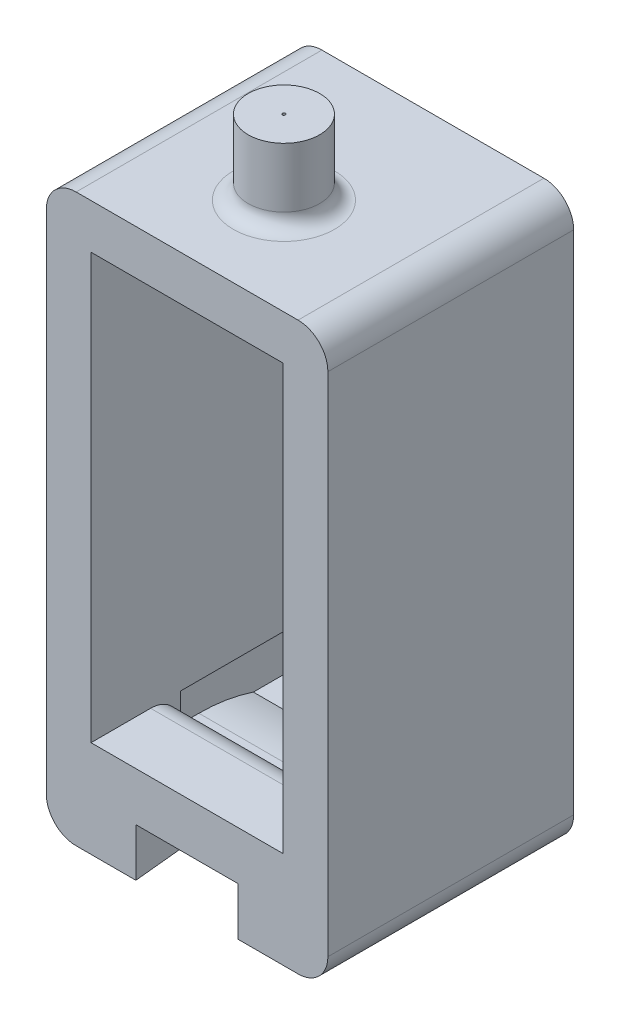
from build123d import *

# Parameters (mm, degrees)
SKETCH_1_W                = 32.6
SKETCH_1_H                = 34.6
SKETCH_1_R                = 1.1
SKETCH_1_R_2              = 1.25
SKETCH_1_W_2              = 24.6
SKETCH_1_H_2              = 24.2
EXTRUDE_1_DEPTH           = 13
SKETCH_3_W                = 6.5
SKETCH_3_H                = 6.519005167
CUT_EXTRUDE_1_DEPTH       = 19
SKETCH_4_W                = 6.5
SKETCH_4_H                = 6.467668889
CUT_EXTRUDE_2_DEPTH       = 23
EXTRUDE_2_DEPTH           = 50
SKETCH_1_2_W              = 22.27659965
SKETCH_1_2_H              = 4.598586669
SKETCH_1_2_W_2            = 22.283050596
SKETCH_1_2_H_2            = 4.977540741
CUT_EXTRUDE_5_DEPTH       = 34
FILLET_1_R                = 2
FILLET_2_R                = 2
SKETCH_9_W                = 54.594998093
SKETCH_9_H                = 18.111982385
SKETCH_9_W_2              = 52.534809486
SKETCH_9_H_2              = 12.989301534
CUT_EXTRUDE_6_DEPTH       = 41
FILLET_6_R                = 22
EXTRUDE_4_DEPTH           = 13
SKETCH_13_W               = 5.518907879
SKETCH_13_H               = 8.361822047
CUT_EXTRUDE_8_DEPTH       = 8.5
SKETCH_14_W               = 6.038657432
SKETCH_14_H               = 7.741248121
CUT_EXTRUDE_9_DEPTH       = 8.5
SKETCH_23_OUTSIDE_W       = 35.102
SKETCH_23_OUTSIDE_H       = 56.702
SKETCH_23_OUTSIDE_W_2     = 1.5
SKETCH_23_OUTSIDE_H_2     = 34.6
CUT_EXTRUDE_10_DEPTH      = 104
SKETCH_24_W               = 10.341780897
SKETCH_24_H               = 5.2
SKETCH_24_R               = 1.25
EXTRUDE_5_DEPTH           = 1.5
SKETCH_25_R               = 1.25
CUT_EXTRUDE_11_DEPTH      = 104
SKETCH_26_OUTSIDE_W       = 115.402
SKETCH_26_OUTSIDE_H       = 56.536
SKETCH_26_OUTSIDE_W_2     = 17.268409177
SKETCH_26_OUTSIDE_H_2     = 34.6
CUT_EXTRUDE_12_DEPTH      = 10
SKETCH_27_W               = 2.368409177
SKETCH_27_H               = 25.781356428
EXTRUDE_6_DEPTH           = 1.5
SKETCH_28_R               = 1.1
CUT_EXTRUDE_13_DEPTH      = 10
CUT_EXTRUDE_START         = -2
CUT_EXTRUDE_14_OUTLINE_W  = 0.368409177
CUT_EXTRUDE_14_OUTLINE_H  = 34.6
CUT_EXTRUDE_14_DEPTH      = 3
SKETCH_30_W               = 15.411127821
SKETCH_30_H               = 34.6
EXTRUDE_7_DEPTH           = 1.5
SKETCH_33_W               = 23.9
SKETCH_33_H               = 38.011921137
SKETCH_33_R               = 1.1
EXTRUDE_8_DEPTH           = 15
SKETCH_34_OUTSIDE_W       = 35.468
SKETCH_34_OUTSIDE_H       = 49.58
SKETCH_34_OUTSIDE_W_2     = 18.899009792
SKETCH_34_OUTSIDE_H_2     = 43.211027868
CUT_EXTRUDE_15_DEPTH      = 13.5
SKETCH_35_W               = 12.9
SKETCH_35_H               = 31.784162084
CUT_EXTRUDE_16_DEPTH      = 11
SKETCH_37_R               = 2.4
EXTRUDE_9_DEPTH           = 5
SKETCH_39_W               = 13.171271292
SKETCH_39_H               = 33.849019387
CUT_EXTRUDE_17_DEPTH      = 3
FILLET_7_R                = 3
CUT_EXTRUDE_18_DEPTH      = 53.759852886
CUT_EXTRUDE_18_DEPTH_BACK = 53.759852886
SKETCH_40_R               = 0.1
SKETCH_42_W               = 13.648654979
SKETCH_42_H               = 4.665334349
EXTRUDE_10_DEPTH          = 11
CUT_EXTRUDE_19_DEPTH      = 4.493948053
SKETCH_43_R               = 3.607554058
CUT_EXTRUDE_20_DEPTH      = 1
SKETCH_44_W               = 12.990377478
SKETCH_44_H               = 2.596310078
CUT_EXTRUDE_21_DEPTH      = 7.5
SKETCH_46_W               = 13.018615597
SKETCH_46_H               = 10.987054625
EXTRUDE_11_DEPTH          = 1.259502583
SKETCH_48_W               = 7.320827495
SKETCH_48_H               = 3.139430645
EXTRUDE_12_DEPTH          = 1
FILLET_9_R                = 11.5
FILLET_11_R               = 2
CUT_EXTRUDE_23_DEPTH      = 41.086666278
CUT_EXTRUDE_23_DEPTH_BACK = 41.086666278
SKETCH_50_W               = 13.704348931
SKETCH_50_H               = 44.342522193
SKETCH_50_W_2             = 6.251475496
FILLET_12_R               = 2
FILLET_13_R               = 1


with BuildPart() as part:
    # Sketch 1 → 凸台-拉伸1 (new body)
    with BuildSketch(Plane.XY):
        with Locations((-9.850980392, 1.274712581)):
            Rectangle(SKETCH_1_W, SKETCH_1_H)
        with Locations(Location((-15.700980392, 15.424712581, 0), (0, 0, 180))):
            Circle(SKETCH_1_R, mode=Mode.SUBTRACT)
        with Locations(Location((-3.600980392, 15.424712581, 0), (0, 0, 180))):
            Circle(SKETCH_1_R_2, mode=Mode.SUBTRACT)
        with Locations(Location((-15.700980392, -12.875287419, 0), (0, 0, 180))):
            Circle(SKETCH_1_R_2, mode=Mode.SUBTRACT)
        with Locations(Location((-3.600980392, -12.875287419, 0), (0, 0, 180))):
            Circle(SKETCH_1_R_2, mode=Mode.SUBTRACT)
        with Locations((-9.850980392, 1.274712581)):
            Rectangle(SKETCH_1_W_2, SKETCH_1_H_2, mode=Mode.SUBTRACT)
    extrude(amount=EXTRUDE_1_DEPTH)

    # 草图3 → 切除-拉伸1 (cut)
    with BuildSketch(Plane(origin=(0, 0, 0), x_dir=(-1, 0, 0), z_dir=(0, 0, -1))):
        with Locations((15.700980392, -10.82528742)):
            Rectangle(SKETCH_3_W, SKETCH_3_H)
    extrude(amount=-CUT_EXTRUDE_1_DEPTH, mode=Mode.SUBTRACT)

    # 草图4 → 切除-拉伸2 (cut)
    with BuildSketch(Plane.XY.offset(13)):
        with Locations((-3.600980392, -10.82528742)):
            Rectangle(SKETCH_4_W, SKETCH_4_H)
    extrude(amount=-CUT_EXTRUDE_2_DEPTH, mode=Mode.SUBTRACT)

    # 草图5 → 凸台-拉伸2 (add)
    with BuildSketch(Plane(origin=(6.449019608, 0, 0), x_dir=(0, 0, -1), z_dir=(1, 0, 0))):
        Polygon((-13, 18.574712581), (-13, 10.055461473), (-13, -16.025287419), (0, -16.025287419), (0, -15.027567927), (0, 16.282461831), (0, 18.574712581), align=None)
    extrude(amount=EXTRUDE_2_DEPTH)

    # Sketch 1 2 → 切除-拉伸5 (cut)
    with BuildSketch(Plane.XY.offset(13)):
        with Locations((24.037173058, -7.263594431)):
            Rectangle(SKETCH_1_2_W, SKETCH_1_2_H)
        with Locations((24.078382453, 0.81654228)):
            Rectangle(SKETCH_1_2_W_2, SKETCH_1_2_H_2)
    extrude(amount=-CUT_EXTRUDE_5_DEPTH, mode=Mode.SUBTRACT)

    # 圆角1
    fillet_1_edges = [part.edges().sort_by_distance(p)[0] for p in [
        (12.936857155, -1.672228091, 6.5),
        (12.936857155, 3.30531265, 6.5),
        (35.219907751, 3.30531265, 6.5),
        (35.219907751, -1.672228091, 6.5),
        (12.898873233, -9.562887765, 6.5),
        (12.898873233, -4.964301096, 6.5),
        (35.175472883, -4.964301096, 6.5),
        (35.175472883, -9.562887765, 6.5),
    ]]
    fillet(fillet_1_edges, radius=FILLET_1_R)

    # 圆角2
    fillet_2_edges = [part.edges().sort_by_distance(p)[0] for p in [
        (-26.150980392, -16.025287419, 6.5),
        (-26.150980392, 18.574712581, 6.5),
    ]]
    fillet(fillet_2_edges, radius=FILLET_2_R)

    # 草图9 → 切除-拉伸6 (cut)
    with BuildSketch(Plane(origin=(0, 0, 0), x_dir=(-1, 0, 0), z_dir=(0, 0, -1))):
        with Locations((-36.934177516, 16.051357777)):
            Rectangle(SKETCH_9_W, SKETCH_9_H)
        with Locations((-36.653242706, -19.247200889)):
            Rectangle(SKETCH_9_W_2, SKETCH_9_H_2)
    extrude(amount=-CUT_EXTRUDE_6_DEPTH, mode=Mode.SUBTRACT)

    # 圆角6
    # the kernel refuses this fillet: 22 mm, written as the material it adds along each edge
    with BuildSketch(Plane(origin=(9.636678469, 6.995366584, 0), x_dir=(0, 1, 0), z_dir=(0, 0, 1))) as fillet_6_piece_1:
        with BuildLine():
            CenterArc((22, -19.375499223), FILLET_6_R, 118.272534833, 61.727465167)
            Line((0, -19.375499223), (-0.44, -19.375499223))
            Line((-0.44, -19.375499223), (-0.44, 0))
            Line((-0.44, 0), (0, 0.44))
            ThreePointArc((0, 0.44), (5.789672998, 0.44), (11.370932916, 0.387509984))
            Line((11.370932916, 0.387509984), (11.579345996, 0))
        make_face()
    extrude(amount=13)
    with BuildSketch(Plane(origin=(10.385837963, -12.752550122, 0), x_dir=(1, 0, 0), z_dir=(0, 0, 1))) as fillet_6_piece_2:
        with BuildLine():
            CenterArc((11.54511289, -22), FILLET_6_R, 90, 31.653290012)
            Line((0, -3.272737297), (-0.230902258, -2.898192043))
            ThreePointArc((-0.230902258, -2.898192043), (-0.44, -1.636368649), (-0.44, 0))
            Line((-0.44, 0), (0, 0.44))
            Line((0, 0.44), (11.54511289, 0.44))
            Line((11.54511289, 0.44), (11.54511289, 0))
        make_face()
    extrude(amount=13)

    # 草图12 → 凸台-拉伸4 (add)
    with BuildSketch(Plane(origin=(0, 0, 0), x_dir=(-1, 0, 0), z_dir=(0, 0, -1))):
        with BuildLine():
            Line((24.150980392, 18.574712581), (24.496655084, -15.99518818))
            ThreePointArc((24.496655084, -15.99518818), (37.015647173, 1.416671567), (24.150980392, 18.574712581))
        make_face()
        with BuildLine():
            Line((26.822698684, 1.289948959), (26.822698684, -8.431688638))
            ThreePointArc((26.822698684, -8.431688638), (32.027920461, 1.289948959), (26.822698684, 11.011586556))
            Line((26.822698684, 11.011586556), (26.822698684, 1.289948959))
        make_face(mode=Mode.SUBTRACT)
    extrude(amount=-EXTRUDE_4_DEPTH)

    # 草图13 → 切除-拉伸8 (cut)
    with BuildSketch(Plane.XY.offset(13)):
        with Locations((-3.600980393, 15.424712581)):
            Rectangle(SKETCH_13_W, SKETCH_13_H)
    extrude(amount=-CUT_EXTRUDE_8_DEPTH, mode=Mode.SUBTRACT)

    # 草图14 → 切除-拉伸9 (cut)
    with BuildSketch(Plane(origin=(0, 0, 0), x_dir=(-1, 0, 0), z_dir=(0, 0, -1))):
        with Locations((15.700980392, 15.424712581)):
            Rectangle(SKETCH_14_W, SKETCH_14_H)
    extrude(amount=-CUT_EXTRUDE_9_DEPTH, mode=Mode.SUBTRACT)

    # 草图23 outside → 切除-拉伸10 (cut)
    with BuildSketch(Plane(origin=(56.449019608, 0, 0), x_dir=(0, 0, -1), z_dir=(1, 0, 0))):
        with Locations((-6.5, 1.275)):
            Rectangle(SKETCH_23_OUTSIDE_W, SKETCH_23_OUTSIDE_H)
        with Locations((-12.25, 1.274712581)):
            Rectangle(SKETCH_23_OUTSIDE_W_2, SKETCH_23_OUTSIDE_H_2, mode=Mode.SUBTRACT)
    extrude(amount=-CUT_EXTRUDE_10_DEPTH, mode=Mode.SUBTRACT)

    # 草图24 → 凸台-拉伸5 (add)
    with BuildSketch(Plane.XY.offset(13)):
        with Locations((-4.17557206, 15.974712581)):
            Rectangle(SKETCH_24_W, SKETCH_24_H)
        with Locations((-3.600980392, 15.429779286)):
            Circle(SKETCH_24_R, mode=Mode.SUBTRACT)
    extrude(amount=-EXTRUDE_5_DEPTH)

    # 草图25 → 切除-拉伸11 (cut)
    with BuildSketch(Plane.XY.offset(13)):
        with Locations((42.624971711, -3.793205976)):
            Circle(SKETCH_25_R)
        with Locations((-34.434765713, 1.289948959)):
            Circle(SKETCH_25_R)
        with Locations((-25.484048207, 14.316394652)):
            Circle(SKETCH_25_R)
        with Locations((-25.484048207, -12.050711449)):
            Circle(SKETCH_25_R)
    extrude(amount=-CUT_EXTRUDE_11_DEPTH, mode=Mode.SUBTRACT)

    # 草图26 outside → 切除-拉伸12 (cut)
    with BuildSketch(Plane.XY.offset(13)):
        with Locations((9.716, 1.275)):
            Rectangle(SKETCH_26_OUTSIDE_W, SKETCH_26_OUTSIDE_H)
        with Locations((-15.516775803, 1.274712581)):
            Rectangle(SKETCH_26_OUTSIDE_W_2, SKETCH_26_OUTSIDE_H_2, mode=Mode.SUBTRACT)
    extrude(amount=-CUT_EXTRUDE_12_DEPTH, mode=Mode.SUBTRACT)

    # 草图27 → 凸台-拉伸6 (add)
    with BuildSketch(Plane.XY.offset(13)):
        with Locations((-8.066775804, 0.484034367)):
            Rectangle(SKETCH_27_W, SKETCH_27_H)
    extrude(amount=-EXTRUDE_6_DEPTH)

    # 草图28 → 切除-拉伸13 (cut)
    with BuildSketch(Plane.XY.offset(13)):
        with Locations((-19.200980392, 15.384992379)):
            Circle(SKETCH_28_R)
        with Locations((-12.200980392, 15.384992379)):
            Circle(SKETCH_28_R)
    extrude(amount=-CUT_EXTRUDE_13_DEPTH, mode=Mode.SUBTRACT)

    # 切除-拉伸14: read off the stored shape, not the designer's step
    # 切除-拉伸14 outline → 切除-拉伸14 (cut)
    with BuildSketch(Plane.XY.offset(13).offset(CUT_EXTRUDE_START)):
        with Locations((-7.066775804, 1.274712581)):
            Rectangle(CUT_EXTRUDE_14_OUTLINE_W, CUT_EXTRUDE_14_OUTLINE_H)
    extrude(amount=CUT_EXTRUDE_14_DEPTH, mode=Mode.SUBTRACT)

    # 草图30 → 凸台-拉伸7 (add)
    with BuildSketch(Plane.XY.offset(13)):
        Polygon((-27.650980392, 18.574712581), (-27.650980392, -16.025287419), (-27.650980392, -17.319235473), (-3.750980392, -17.319235473), (-3.750980392, -16.025287419), (-3.750980392, 18.574712581), (-3.750980392, 20.692685664), (-27.650980392, 20.692685664), align=None)
        with Locations((-15.213421192, 1.274712581)):
            Rectangle(SKETCH_30_W, SKETCH_30_H, mode=Mode.SUBTRACT)
    extrude(amount=-EXTRUDE_7_DEPTH)

    # 草图33 → 凸台-拉伸8 (add)
    with BuildSketch(Plane(origin=(0, 0, 11.5), x_dir=(-1, 0, 0), z_dir=(0, 0, -1))):
        with Locations((15.700980392, 1.686725095)):
            Rectangle(SKETCH_33_W, SKETCH_33_H)
        with Locations((15.700980392, 15.424712581)):
            Circle(SKETCH_33_R, mode=Mode.SUBTRACT)
        with Locations(Location((12.200980392, 15.384992379, 0), (0, 0, 180))):
            Circle(SKETCH_33_R, mode=Mode.SUBTRACT)
        with Locations(Location((19.200980392, 15.384992379, 0), (0, 0, 180))):
            Circle(SKETCH_33_R, mode=Mode.SUBTRACT)
        with BuildLine():
            Line((9.250980392, -10.825287419), (12.450980392, -10.825287419))
            Line((12.450980392, -10.825287419), (12.450980392, -14.084790003))
            Line((12.450980392, -14.084790003), (15.385380168, -14.084790003))
            ThreePointArc((15.385380168, -14.084790003), (15.700980392, -14.125287419), (16.016580616, -14.084790003))
            Line((16.016580616, -14.084790003), (18.950980392, -14.084790003))
            Line((18.950980392, -14.084790003), (18.950980392, -10.825287419))
            Line((18.950980392, -10.825287419), (22.150980392, -10.825287419))
            Line((22.150980392, -10.825287419), (22.150980392, 13.374712581))
            Line((22.150980392, 13.374712581), (9.250980392, 13.374712581))
            Line((9.250980392, 13.374712581), (9.250980392, -10.825287419))
        make_face(mode=Mode.SUBTRACT)
    extrude(amount=EXTRUDE_8_DEPTH)

    # 草图34 outside → 切除-拉伸15 (cut)
    with BuildSketch(Plane.XY.offset(13)):
        with Locations((-15.701, 1.687)):
            Rectangle(SKETCH_34_OUTSIDE_W, SKETCH_34_OUTSIDE_H)
        with Locations((-15.700980392, 2.766642636)):
            Rectangle(SKETCH_34_OUTSIDE_W_2, SKETCH_34_OUTSIDE_H_2, mode=Mode.SUBTRACT)
    extrude(amount=-CUT_EXTRUDE_15_DEPTH, mode=Mode.SUBTRACT)

    # 草图35 → 切除-拉伸16 (cut)
    with BuildSketch(Plane.XY.offset(13)):
        with Locations((-15.700980392, 1.798395824)):
            Rectangle(SKETCH_35_W, SKETCH_35_H)
    extrude(amount=-CUT_EXTRUDE_16_DEPTH, mode=Mode.SUBTRACT)

    # 草图37 → 凸台-拉伸9 (add)
    with BuildSketch(Plane(origin=(0, 20.692685664, 0), x_dir=(1, 0, 0), z_dir=(0, 1, 0))):
        with Locations(Location((-15.700980392, -6.5, 0), (0, 0, 270))):
            Circle(SKETCH_37_R)
    extrude(amount=EXTRUDE_9_DEPTH)

    # 草图39 → 切除-拉伸17 (cut)
    with BuildSketch(Plane(origin=(0, 0, -3.5), x_dir=(-1, 0, 0), z_dir=(0, 0, -1))):
        with Locations((15.655722224, 1.624936556)):
            Rectangle(SKETCH_39_W, SKETCH_39_H)
    extrude(amount=-CUT_EXTRUDE_17_DEPTH, mode=Mode.SUBTRACT)

    # 圆角7
    fillet_7_edges = [part.edges().sort_by_distance(p)[0] for p in [
        (-3.750980392, 20.692685664, -2),
        (-27.650980392, 20.692685664, -2),
        (-27.650980392, -17.319235473, -2),
        (-3.750980392, -17.319235473, -2),
    ]]
    fillet(fillet_7_edges, radius=FILLET_7_R)

    # 草图40 → 切除-拉伸18 (cut, two sides: drawn at the far end of the back side and taken through both)
    with BuildSketch(Plane(origin=(0, 25.692685664, 0), x_dir=(1, 0, 0), z_dir=(0, 1, 0)).offset(-CUT_EXTRUDE_18_DEPTH_BACK)):
        with Locations(Location((-15.700980392, -6.5, 0), (0, 0, 270))):
            Circle(SKETCH_40_R)
    extrude(amount=CUT_EXTRUDE_18_DEPTH + CUT_EXTRUDE_18_DEPTH_BACK, mode=Mode.SUBTRACT)

    # 草图42 → 凸台-拉伸10 (add)
    with BuildSketch(Plane.XY.offset(2)):
        with Locations((-15.66246504, -13.157954594)):
            Rectangle(SKETCH_42_W, SKETCH_42_H)
    extrude(amount=EXTRUDE_10_DEPTH)

    # 草图41 → 切除-拉伸19 (cut)
    with BuildSketch(Plane.XZ.offset(17.319235473)):
        with BuildLine():
            Line((-19.775980392, 6.5), (-18.406082759, 20.501521641))
            ThreePointArc((-18.406082759, 20.501521641), (-15.665794747, 23.749766381), (-13.011106202, 20.431197259))
            Line((-13.011106202, 20.431197259), (-11.625980392, 6.5))
            ThreePointArc((-11.625980392, 6.5), (-15.700980392, 2.425), (-19.775980392, 6.5))
        make_face()
    extrude(amount=-CUT_EXTRUDE_19_DEPTH, mode=Mode.SUBTRACT)

    # 草图43 → 切除-拉伸20 (cut)
    with BuildSketch(Plane.XZ.offset(12.825287419)):
        with Locations(Location((-15.700980392, 6.5, 0), (0, 0, 270))):
            Circle(SKETCH_43_R)
    extrude(amount=-CUT_EXTRUDE_20_DEPTH, mode=Mode.SUBTRACT)

    # 草图44 → 切除-拉伸21 (cut)
    with BuildSketch(Plane(origin=(0, 0, -0.5), x_dir=(-1, 0, 0), z_dir=(0, 0, -1))):
        with Locations((15.746169131, -12.123442458)):
            Rectangle(SKETCH_44_W, SKETCH_44_H)
    extrude(amount=-CUT_EXTRUDE_21_DEPTH, mode=Mode.SUBTRACT)

    # 草图46 → 凸台-拉伸11 (add)
    with BuildSketch(Plane.XZ.offset(12.825287419)):
        with Locations((-15.749811773, 7.506472688)):
            Rectangle(SKETCH_46_W, SKETCH_46_H)
    extrude(amount=EXTRUDE_11_DEPTH)

    # 草图48 → 凸台-拉伸12 (add)
    with BuildSketch(Plane.XZ.offset(11.825287419)):
        with Locations((-15.761363582, 8.5864607)):
            Rectangle(SKETCH_48_W, SKETCH_48_H)
    extrude(amount=EXTRUDE_12_DEPTH)

    # 圆角9
    # the kernel refuses this fillet: 11.5 mm, written as the material it takes off along each edge
    with BuildSketch(Plane(origin=(-22.24135787, -12.825287419, 2.012945375), x_dir=(0, -1.0, 1.3077435417698884e-12), z_dir=(1, 0, 0))) as fillet_9_piece_1:
        with BuildLine():
            CenterArc((11.5, -3.655071281), FILLET_9_R, 161.468118769, 18.531881231)
            Line((0, -3.655071281), (0, 0))
            Line((0, 0), (0.596310077, 0))
        make_face()
    extrude(amount=12.990377478, mode=Mode.SUBTRACT)

    # 圆角11
    # the kernel refuses this fillet: 2 mm, written as the material it takes off along each edge
    with BuildSketch(Plane(origin=(-9.250980392, -10.825287419, 7), x_dir=(0, 0, 1), z_dir=(-1, 0, 0))) as fillet_11_piece_1:
        with BuildLine():
            CenterArc((FILLET_11_R, -FILLET_11_R), FILLET_11_R, 90, 90)
            Line((0, -FILLET_11_R), (0, 0))
            Line((0, 0), (FILLET_11_R, 0))
        make_face()
    extrude(amount=12.9, mode=Mode.SUBTRACT)

    # 草图50 → 切除-拉伸23 (cut, two sides: drawn at the far end of the back side and taken through both)
    with BuildSketch(Plane.XY.offset(-0.5).offset(-CUT_EXTRUDE_23_DEPTH_BACK)):
        with Locations((-32.002659754, -1.520451896)):
            Rectangle(SKETCH_50_W, SKETCH_50_H)
        with Locations((-3.125737748, -1.520451896)):
            Rectangle(SKETCH_50_W_2, SKETCH_50_H)
    extrude(amount=CUT_EXTRUDE_23_DEPTH + CUT_EXTRUDE_23_DEPTH_BACK, mode=Mode.SUBTRACT)

    # 圆角12
    # the kernel refuses this fillet: 2 mm, written as the material it takes off along each edge
    with BuildSketch(Plane(origin=(-25.150485288, -17.27735901, 18.001095904), x_dir=(0.9997808672786077, -0.02093364334354982, 0), z_dir=(0, 0, -1))) as fillet_12_piece_1:
        with BuildLine():
            CenterArc((1.958571075, -1.999561735), FILLET_12_R, 88.800502969, 90)
            Line((-0.04099066, -1.957694448), (-0.240946833, -1.953507719))
            Line((-0.240946833, -1.953507719), (-0.199956173, 0.004186729))
            Line((-0.199956173, 0.004186729), (-0.029164742, 0.197862118))
            ThreePointArc((-0.029164742, 0.197862118), (0.504458794, 0.231367003), (2.00462509, 0.199956173))
            Line((2.00462509, 0.199956173), (2.000438362, 0))
        make_face()
    extrude(amount=26.502191808, mode=Mode.SUBTRACT)
    with BuildSketch(Plane(origin=(-6.251475496, -17.27735901, -8.501095904), x_dir=(0, 1, 0), z_dir=(0, 0, 1))) as fillet_12_piece_2:
        with BuildLine():
            CenterArc((1.958123537, 2), FILLET_12_R, 180, 90)
            Line((-0.041876463, 2), (-0.241876463, 2))
            ThreePointArc((-0.241876463, 2), (-0.241876463, 0.499504896), (-0.197208236, -0.033300326))
            Line((-0.197208236, -0.033300326), (0, -0.2))
            Line((0, -0.2), (1.958123537, -0.2))
            Line((1.958123537, -0.2), (1.958123537, 0))
        make_face()
    extrude(amount=26.502191808, mode=Mode.SUBTRACT)
    with BuildSketch(Plane(origin=(-6.251475496, 20.650809201, -8.501095904), x_dir=(-0.9997808672786077, 0.020933643343547987, -1.13466853616475e-15), z_dir=(0, 0, 1))) as fillet_12_piece_3:
        with BuildLine():
            CenterArc((1.958571075, 1.999561735), FILLET_12_R, 181.199497031, 90)
            Line((-0.04099066, 1.957694448), (-0.240946833, 1.953507719))
            Line((-0.240946833, 1.953507719), (-0.199956173, -0.004186729))
            Line((-0.199956173, -0.004186729), (-0.029164742, -0.197862118))
            ThreePointArc((-0.029164742, -0.197862118), (0.504458794, -0.231367003), (2.00462509, -0.199956173))
            Line((2.00462509, -0.199956173), (2.000438362, 0))
        make_face()
    extrude(amount=26.502191808, mode=Mode.SUBTRACT)
    with BuildSketch(Plane(origin=(-25.150485288, 20.650809201, 18.001095904), x_dir=(0, -1, 0), z_dir=(0, 0, -1))) as fillet_12_piece_4:
        with BuildLine():
            CenterArc((1.958123537, -2), FILLET_12_R, 90, 90)
            Line((-0.041876463, -2), (-0.241876463, -2))
            ThreePointArc((-0.241876463, -2), (-0.241876463, -0.499504896), (-0.197208236, 0.033300326))
            Line((-0.197208236, 0.033300326), (0, 0.2))
            Line((0, 0.2), (1.958123537, 0.2))
            Line((1.958123537, 0.2), (1.958123537, 0))
        make_face()
    extrude(amount=26.502191808, mode=Mode.SUBTRACT)

    # 圆角13
    fillet_13_edges = [part.edges().sort_by_distance(p)[0] for p in [
        (-15.700980392, 20.692685664, 4.1),
    ]]
    fillet(fillet_13_edges, radius=FILLET_13_R)


solid = part.part
